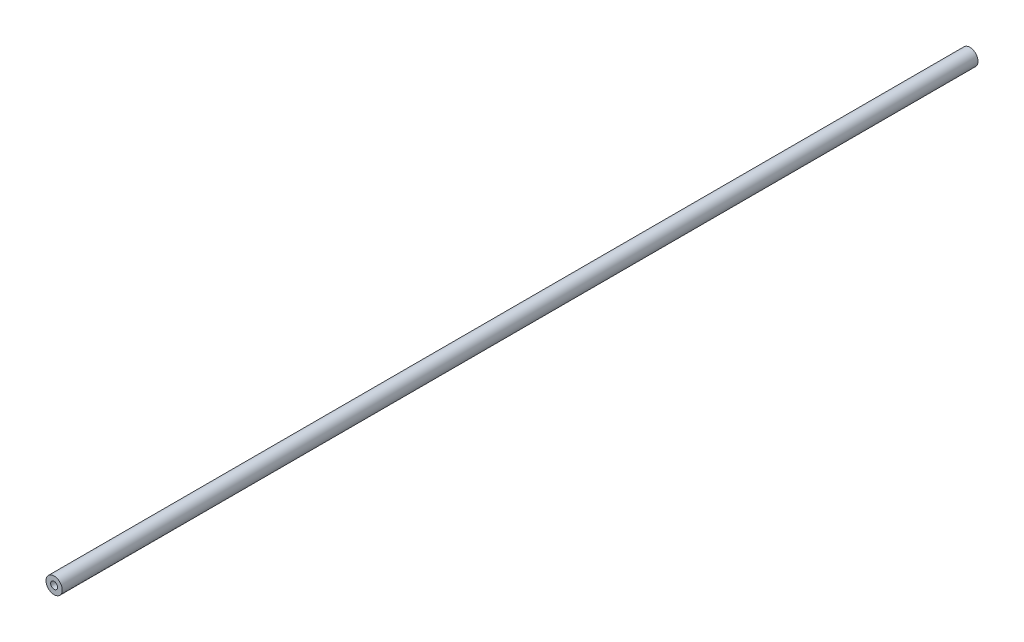
from build123d import *

# Parameters (mm, degrees)
SKETCH1_R           = 4.7625
BOSS_EXTRUDE1_DEPTH = 268.2875


# Read off the part's stored shape, not the designer's step: #10-32 Tapped Hole1
with BuildPart() as part:
    # Sketch1 → Boss-Extrude1 (new, symmetric)
    with BuildSketch(Plane.XY):
        Circle(SKETCH1_R)
    extrude(amount=BOSS_EXTRUDE1_DEPTH, both=True)

    # #10-32 Tapped Hole1 outline → #10-32 Tapped Hole1 (revolve, cut)
    with BuildSketch(Plane.XZ):
        Polygon((2.0193, -256.25806), (0, -255.044742152), (0, -268.2875), (2.0193, -268.2875), align=None)
        Polygon((0, 268.2875), (0, 255.044742152), (2.0193, 256.25806), (2.0193, 268.2875), align=None)
    revolve(axis=Axis((0, 0, 0), (0, 0, 1)), mode=Mode.SUBTRACT)


solid = part.part
